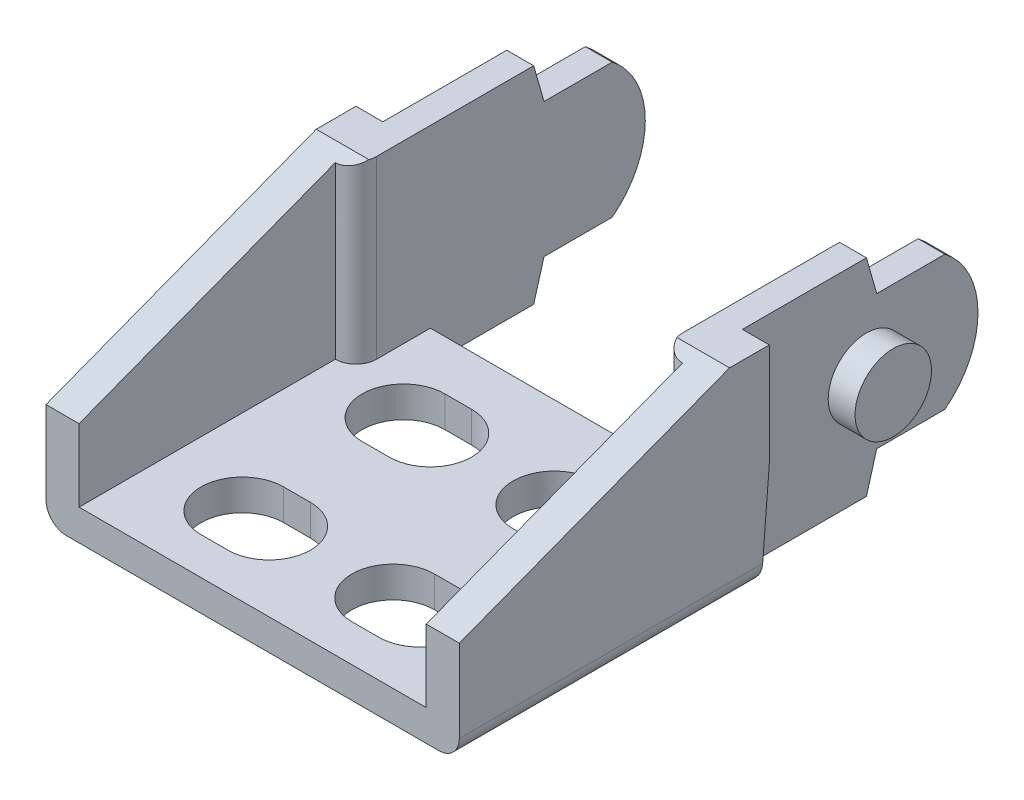
from build123d import *

# Parameters (mm, degrees)
SKETCH1_W           = 20
SKETCH1_H           = 16
BOSS_EXTRUDE1_DEPTH = 1.5
BOSS_EXTRUDE2_DEPTH = 2.6
CUT_EXTRUDE1_DEPTH  = 1
SKETCH4_R           = 1.85
CUT_EXTRUDE2_DEPTH  = 1.3
CUT_EXTRUDE3_DEPTH  = 4.3
FILLET1_R           = 1


with BuildPart() as part:
    # Sketch1 → Boss-Extrude1 (new body)
    with BuildSketch(Plane(origin=(0, 0, 0), x_dir=(1, 0, 0), z_dir=(0, 1, 0))):
        Rectangle(SKETCH1_W, SKETCH1_H)
    extrude(amount=BOSS_EXTRUDE1_DEPTH)

    # Sketch2 → Boss-Extrude2 (add)
    with BuildSketch(Plane.ZY.offset(10)):
        with BuildLine():
            Line((8, 0), (8, 5))
            Line((8, 5), (-5.076696831, 10))
            Line((-5.076696831, 10), (-13, 10))
            Line((-13, 10), (-13.5, 8.25))
            Line((-13.5, 8.25), (-16.8, 8.25))
            ThreePointArc((-16.8, 8.25), (-18.4, 5), (-16.8, 1.75))
            Line((-16.8, 1.75), (-13.5, 1.75))
            Line((-13.5, 1.75), (-13, 0))
            Line((-13, 0), (8, 0))
        make_face()
    boss_extrude2 = extrude(amount=-BOSS_EXTRUDE2_DEPTH)

    # Sketch3 → Cut-Extrude1 (cut)
    with BuildSketch(Plane(origin=(-7.4, 0, 0), x_dir=(0, 0, -1), z_dir=(1, 0, 0))):
        Polygon((-8, 1.5), (4.4, 1.5), (4.4, 9.7412585), (-8, 5), align=None)
    cut_extrude1 = extrude(amount=-CUT_EXTRUDE1_DEPTH, mode=Mode.SUBTRACT)

    # Sketch4 → Cut-Extrude2 (cut)
    with BuildSketch(Plane.ZY.offset(10)):
        Polygon((-18.672915143, 10), (-7, 10), (-7, 5), (-6.6, 0), (-8.743784953, 0), (-18.672915143, 0), align=None)
        with Locations((-13, 5)):
            Circle(SKETCH4_R, mode=Mode.SUBTRACT)
    cut_extrude2 = extrude(amount=-CUT_EXTRUDE2_DEPTH, mode=Mode.SUBTRACT)

    # Mirror1: Boss-Extrude2, Cut-Extrude1, Cut-Extrude2 across plane
    add(boss_extrude2.mirror(Plane(origin=(0, 0, 0), x_dir=(0, 0, 1), z_dir=(1, 0, 0))))
    add(cut_extrude1.mirror(Plane(origin=(0, 0, 0), x_dir=(0, 0, 1), z_dir=(1, 0, 0))), mode=Mode.SUBTRACT)
    add(cut_extrude2.mirror(Plane(origin=(0, 0, 0), x_dir=(0, 0, 1), z_dir=(1, 0, 0))), mode=Mode.SUBTRACT)

    # Sketch5 → Cut-Extrude3 (cut)
    with BuildSketch(Plane.XZ):
        with BuildLine():
            Line((-4.3, 6.2), (-3, 6.2))
            ThreePointArc((-3, 6.2), (-1, 4.2), (-3, 2.2))
            Line((-3, 2.2), (-4.3, 2.2))
            ThreePointArc((-4.3, 2.2), (-6.3, 4.2), (-4.3, 6.2))
        make_face()
        with BuildLine():
            Line((3, 6.2), (4.3, 6.2))
            ThreePointArc((4.3, 6.2), (6.3, 4.2), (4.3, 2.2))
            Line((4.3, 2.2), (3, 2.2))
            ThreePointArc((3, 2.2), (1, 4.2), (3, 6.2))
        make_face()
        with BuildLine():
            Line((-4.3, -1.6), (-3, -1.6))
            ThreePointArc((-3, -1.6), (-1, -3.6), (-3, -5.6))
            Line((-3, -5.6), (-4.3, -5.6))
            ThreePointArc((-4.3, -5.6), (-6.3, -3.6), (-4.3, -1.6))
        make_face()
        with BuildLine():
            Line((3, -1.6), (4.3, -1.6))
            ThreePointArc((4.3, -1.6), (6.3, -3.6), (4.3, -5.6))
            Line((4.3, -5.6), (3, -5.6))
            ThreePointArc((3, -5.6), (1, -3.6), (3, -1.6))
        make_face()
    extrude(amount=-CUT_EXTRUDE3_DEPTH, mode=Mode.SUBTRACT)

    # Fillet1
    fillet1_edges = [part.edges().sort_by_distance(p)[0] for p in [
        (-7.4, 5.62062925, -4.4),
        (10, 0, 0.7),
        (-10, 0, 0.7),
        (7.4, 5.62062925, -4.4),
    ]]
    fillet(fillet1_edges, radius=FILLET1_R - 0.0001)  # a hair under: the kernel refuses the full size


solid = part.part
